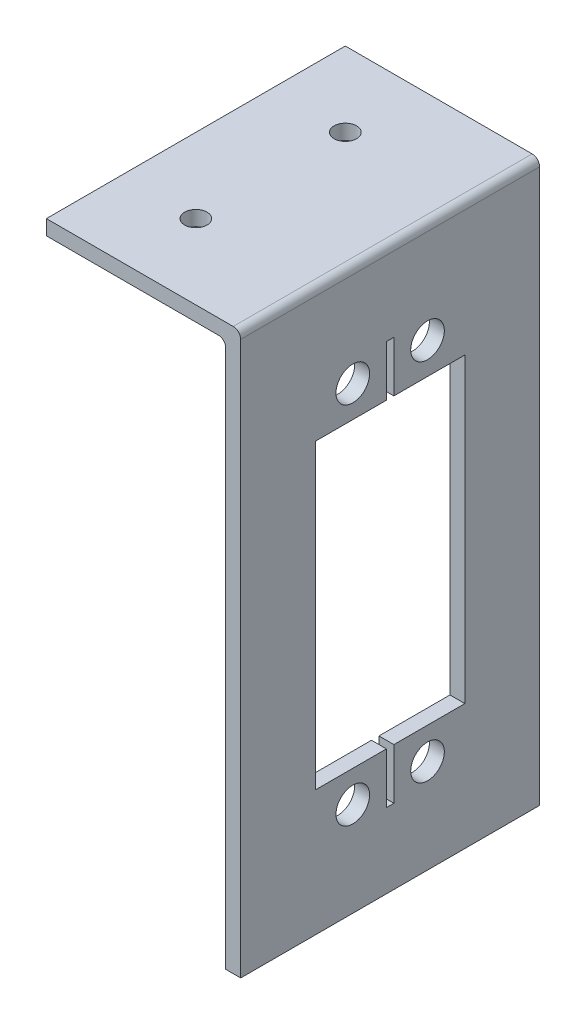
from build123d import *

# Parameters (mm, degrees)
SKETCH1_W           = 25
SKETCH1_H           = 40
SKETCH1_R           = 1.5
BOSS_EXTRUDE1_DEPTH = 2
BOSS_EXTRUDE2_DEPTH = 75
FILLET1_R           = 1
SKETCH3_R           = 2.25
CUT_EXTRUDE1_DEPTH  = 75


with BuildPart() as part:
    # Sketch1 → Boss-Extrude1 (new body)
    with BuildSketch(Plane(origin=(0, 0, 0), x_dir=(1, 0, 0), z_dir=(0, 1, 0))):
        with Locations((12.5, 20)):
            Rectangle(SKETCH1_W, SKETCH1_H)
        with Locations((10, 30)):
            Circle(SKETCH1_R, mode=Mode.SUBTRACT)
        with Locations((10, 10)):
            Circle(SKETCH1_R, mode=Mode.SUBTRACT)
    extrude(amount=BOSS_EXTRUDE1_DEPTH)

    # Sketch2 → Boss-Extrude2 (add)
    with BuildSketch(Plane(origin=(0, 2, 0), x_dir=(1, 0, 0), z_dir=(0, 1, 0))):
        Polygon((25, 40), (24, 40), (24, 0), (25, 0), (26, 0), (26, 40), align=None)
    extrude(amount=-BOSS_EXTRUDE2_DEPTH)

    # Fillet1
    fillet1_edges = [part.edges().sort_by_distance(p)[0] for p in [
        (24, 0, -20),
        (26, 2, -20),
    ]]
    fillet(fillet1_edges, radius=FILLET1_R)

    # Sketch3 → Cut-Extrude1 (cut)
    with BuildSketch(Plane.ZY.offset(-24)):
        Polygon((-19.5, -9), (-20.5, -9), (-20.5, -15.8), (-30, -15.8), (-30, -56.2), (-20.5, -56.2), (-20.5, -63), (-19.5, -63), (-19.5, -56.2), (-10, -56.2), (-10, -15.8), (-19.5, -15.8), align=None)
        with Locations((-25, -11.6)):
            Circle(SKETCH3_R)
        with Locations((-15, -11.6)):
            Circle(SKETCH3_R)
        with Locations((-15, -60.4)):
            Circle(SKETCH3_R)
        with Locations((-25, -60.4)):
            Circle(SKETCH3_R)
    extrude(amount=-CUT_EXTRUDE1_DEPTH, mode=Mode.SUBTRACT)


solid = part.part
